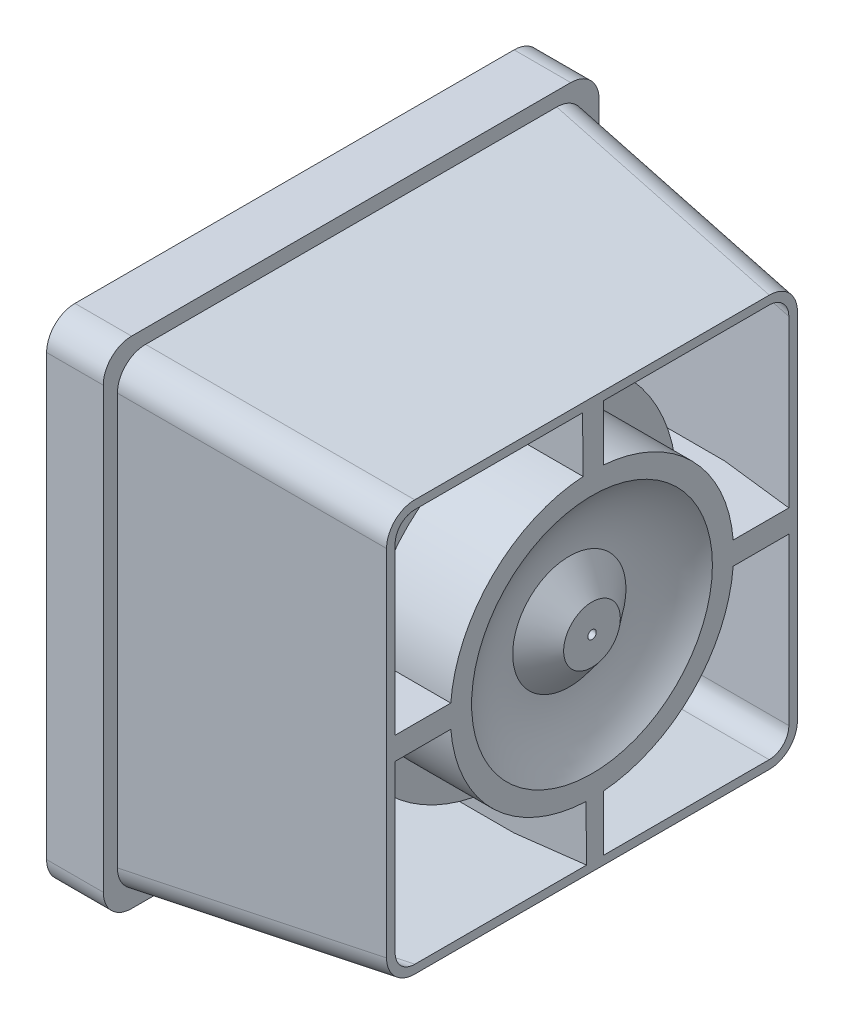
from build123d import *

# Parameters (mm, degrees)
FILLET1_R           = 1
SHELL4_T            = -0.3
SKETCH3_W           = 17.5
SKETCH3_H           = 17.5
BOSS_EXTRUDE1_DEPTH = 2
FILLET2_R           = 1
BOSS_EXTRUDE4_DEPTH = 8.5
FILLET4_R           = 0.5
CUT_EXTRUDE1_DEPTH  = 0.5


# Read off the part's stored shape, not the designer's step: Boss-Extrude4
with BuildPart() as part:
    # Sketch1 → Loft1 section 0
    with BuildSketch(Plane(origin=(0, 0, 0), x_dir=(0, 0, -1), z_dir=(1, 0, 0))):
        with BuildLine():
            Line((-8.25, -8.25), (8.25, -8.25))
            Line((8.25, -8.25), (8.25, 8.25))
            Line((8.25, 8.25), (-8.25, 8.25))
            Line((-8.25, 8.25), (-8.25, -8.25))
        make_face()
    # Sketch2 → Loft1 section 1
    with BuildSketch(Plane.ZY.offset(-8.5)):
        with BuildLine():
            Line((-7.25, -7.25), (7.25, -7.25))
            Line((7.25, -7.25), (7.25, 7.25))
            Line((7.25, 7.25), (-7.25, 7.25))
            Line((-7.25, 7.25), (-7.25, -7.25))
        make_face()
    loft()

    # Fillet1
    fillet1_edges = [part.edges().sort_by_distance(p)[0] for p in [
        (4.25, -7.75, -7.75),
        (4.25, -7.75, 7.75),
        (4.25, 7.75, -7.75),
        (4.25, 7.75, 7.75),
    ]]
    fillet(fillet1_edges, radius=FILLET1_R)

    # Shell4
    shell4_openings = [part.faces().sort_by_distance(p)[0] for p in [
        (8.5, 0, 0),
        (0, 0, 0),
    ]]
    offset(amount=SHELL4_T, openings=shell4_openings)

    # Sketch3 → Boss-Extrude1 (add)
    with BuildSketch(Plane(origin=(0, 0, 0), x_dir=(0, 0, -1), z_dir=(1, 0, 0))):
        Rectangle(SKETCH3_W, SKETCH3_H)
    extrude(amount=-BOSS_EXTRUDE1_DEPTH)

    # Fillet2
    fillet2_edges = [part.edges().sort_by_distance(p)[0] for p in [
        (-1, 8.75, -8.75),
        (-1, -8.75, -8.75),
        (-1, -8.75, 8.75),
        (-1, 8.75, 8.75),
    ]]
    fillet(fillet2_edges, radius=FILLET2_R)

    # Sketch5 → Revolve3 (revolve)
    with BuildSketch(Plane.XY, mode=Mode.PRIVATE) as revolve3_sk:
        with BuildLine():
            Line((0, 0), (0, 6))
            Line((0, 6), (5.5, 6))
            Line((5.5, 6), (5.5, 5))
            Line((5.5, 5), (8.5, 5))
            Line((8.5, 5), (8.5, 4.25))
            ThreePointArc((8.5, 4.25), (7.905950455, 3.193995394), (7.7, 2))
            Line((7.7, 2), (8.5, 1))
            Line((8.5, 1), (8.5, 0))
            Line((8.5, 0), (0, 0))
        make_face()
    revolve(revolve3_sk.sketch.rotate(Axis((8.5, 0, 0), (-1, 0, 0)), 90), axis=Axis((8.5, 0, 0), (-1, 0, 0)))

    # Boss-Extrude4 outline → Boss-Extrude4 (add)
    with BuildSketch(Plane(origin=(0, 0, 0), x_dir=(0, 0, -1), z_dir=(1, 0, 0))):
        with BuildLine():
            Line((7.25, -0.4), (7.25, 0.4))
            Line((7.25, 0.4), (4.983974318, 0.4))
            ThreePointArc((4.983974318, 0.4), (5, 0), (4.983974318, -0.4))
            Line((4.983974318, -0.4), (7.25, -0.4))
        make_face()
        with BuildLine():
            Line((-0.211850638, -4.995509915), (-0.188879124, -7.25))
            Line((-0.188879124, -7.25), (0.4, -7.25))
            Line((0.4, -7.25), (0.4, -4.983974318))
            ThreePointArc((0.4, -4.983974318), (0.094251329, -4.99911159), (-0.211850638, -4.995509915))
        make_face()
        with BuildLine():
            Line((-0.336622937, 7.25), (-0.313596871, 4.99015601))
            ThreePointArc((-0.313596871, 4.99015601), (0.04331199, 4.999812404), (0.4, 4.983974318))
            Line((0.4, 4.983974318), (0.4, 7.25))
            Line((0.4, 7.25), (-0.336622937, 7.25))
        make_face()
        with BuildLine():
            Line((-4.983974318, 0.4), (-7.25, 0.4))
            Line((-7.25, 0.4), (-7.25, -0.4))
            Line((-7.25, -0.4), (-4.983974318, -0.4))
            ThreePointArc((-4.983974318, -0.4), (-5, 0), (-4.983974318, 0.4))
        make_face()
    extrude(amount=BOSS_EXTRUDE4_DEPTH)

    # Sketch7 → Cut-Revolve2 (revolve, cut)
    with BuildSketch(Plane.XY):
        Polygon((-2, 0), (-2, 4.5), (-0.2, 4.5), (0, 4.85), (0.5, 4.85), (1.6375, 4.2), (6.7, 4.2), (6.7, 3.5), (3.1, 3.5), (3.1, 2.5), (6.7, 2.5), (6.7, 0), align=None)
    revolve(axis=Axis((6.7, 0, 0), (-1, 0, 0)), mode=Mode.SUBTRACT)

    # Fillet4
    fillet4_edges = [part.edges().sort_by_distance(p)[0] for p in [
        (3.1, -2.5, 0),
    ]]
    fillet(fillet4_edges, radius=FILLET4_R)

    # Sketch9 → Cut-Extrude1 (cut)
    with BuildSketch(Plane.ZY.offset(-6.7)):
        with BuildLine():
            Line((0.75, 2), (-0.75, 2))
            Line((-0.75, 2), (-0.75, -1.25))
            ThreePointArc((-0.75, -1.25), (-0.530330086, -1.780330086), (0, -2))
            ThreePointArc((0, -2), (0.303045763, -1.874474335), (0.428571429, -1.571428571))
            ThreePointArc((0.428571429, -1.571428571), (0.251190476, -1.039285714), (-0.21, -0.72))
            ThreePointArc((-0.21, -0.72), (0.45, -0.6), (0.75, 0))
            Line((0.75, 0), (0.75, 2))
        make_face()
    extrude(amount=-CUT_EXTRUDE1_DEPTH, mode=Mode.SUBTRACT)

    # Sketch10 → Cut-Revolve3 (revolve, cut)
    with BuildSketch(Plane.XY, mode=Mode.PRIVATE) as cut_revolve3_sk:
        Polygon((8.5, 0), (6.372171637, 0), (6.372171637, 0.75), (7.2, 0.75), (7.546410162, 0.15), (8.5, 0.15), align=None)
    revolve(cut_revolve3_sk.sketch.rotate(Axis((8.5, 0, 0), (-1, 0, 0)), 90), axis=Axis((8.5, 0, 0), (-1, 0, 0)), mode=Mode.SUBTRACT)


solid = part.part
